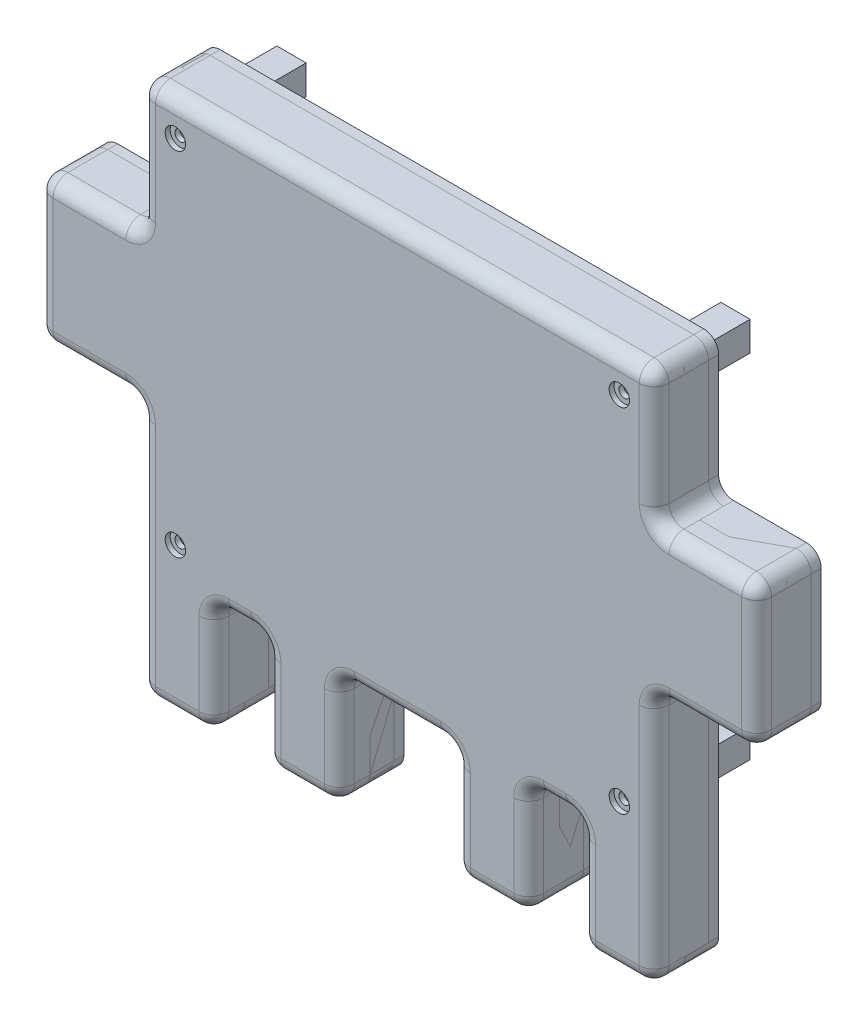
from build123d import *

# Parameters (mm, degrees)
PADTOP_W            = 77.3
PADTOP_H            = 39.1
PADTOP_W_2          = 20
PADTOP_H_2          = 20
PADTOP_W_3          = 20.655745754
PADTOP_H_3          = 29.195655742
PADTOP_R            = 3.75
PADTOP_W_4          = 11.1
PADTOP_H_4          = 11.1
PADTOP_W_5          = 14.76357624
PADTOP_H_5          = 22.646815711
EXTRUDE_1_DEPTH     = 7.8
EXTRUDE_START       = -2
PADTOP_8_W          = 77.3
PADTOP_8_H          = 39.1
PADTOP_8_W_2        = 20
PADTOP_8_H_2        = 20
PADTOP_8_W_3        = 20.655745754
PADTOP_8_H_3        = 29.195655742
PADTOP_8_R          = 3.75
PADTOP_8_W_4        = 14.76357624
PADTOP_8_H_4        = 22.646815711
PADTOP_8_W_5        = 14.1
PADTOP_8_H_5        = 14.1
EXTRUDE_4_DEPTH     = 2
EXTRUDE_6_DEPTH     = 11
FILLET_2_R          = 3
SHELL_1_T           = -2
FILLET_4_R          = 3
SKETCH_5_W          = 2
SKETCH_5_H          = 2
SKETCH_5_W_2        = 4
SKETCH_5_H_2        = 4
EXTRUDE_9_DEPTH     = 11.46
SKETCH_7_R          = 1.1
CUT_EXTRUDE_1_DEPTH = 2
SKETCH_7_4_R        = 2.05
SKETCH_7_4_R_2      = 1.1
CUT_EXTRUDE_2_DEPTH = 1
SKETCH_8_W          = 15.2
SKETCH_8_H          = 12.1
CUT_EXTRUDE_3_DEPTH = 7.4
SKETCH_5_4_W        = 5.9
SKETCH_5_4_H        = 5.9
SKETCH_5_4_W_2      = 1.9
SKETCH_5_4_H_2      = 1.9
EXTRUDE_11_DEPTH    = 10.4
PADTOP_9_W          = 20
PADTOP_9_H          = 20
PADTOP_9_W_2        = 11.1
PADTOP_9_H_2        = 11.1
CUT_EXTRUDE_4_DEPTH = 5
CHAMFER_1_SIZE      = 3


with BuildPart() as part:
    # padTop → 填料-伸長1 (new body)
    # profile 1 of 9: a face of its own
    with BuildSketch(Plane.XY):
        Polygon((124.130335016, 70.452577029), (20.692697881, 70.452577029), (20.692697881, 43.682608944), (20.692697881, 38.79106378), (24.836952127, 38.79106378), (24.836952127, 19.378498366), (20.692697881, 19.378498366), (20.692697881, 14.486953202), (20.692697881, -14.488569064), (35.456274121, -14.488569064), (45.956274121, -14.488569064), (60.719850361, -14.488569064), (84.103182536, -14.488569064), (98.866758776, -14.488569064), (109.366758776, -14.488569064), (124.130335016, -14.488569064), (124.130335016, 14.309507688), (124.130335016, 43.50516343), align=None)
        with Locations((72.411516449, 11.013549732)):
            Rectangle(PADTOP_W, PADTOP_H, mode=Mode.SUBTRACT)
        with Locations((42.913258478, 51.226372894)):
            Rectangle(PADTOP_W_2, PADTOP_H_2, mode=Mode.SUBTRACT)
        with Locations((102.073451812, 51.226372894)):
            Rectangle(PADTOP_W_2, PADTOP_H_2, mode=Mode.SUBTRACT)
    # profile 2 of 9: a face of its own
    with BuildSketch(Plane.XY):
        with Locations((134.458207893, 28.907335559)):
            Rectangle(PADTOP_W_3, PADTOP_H_3)
        with Locations((129.98608077, 29.084781073)):
            Circle(PADTOP_R, mode=Mode.SUBTRACT)
    # profile 3 of 9: a face of its own
    with BuildSketch(Plane.XY):
        Polygon((20.692697881, 38.79106378), (20.692697881, 43.682608944), (0.036952127, 43.682608944), (0.036952127, 14.486953202), (20.692697881, 14.486953202), (20.692697881, 19.378498366), (4.836952127, 19.378498366), (4.836952127, 38.79106378), align=None)
    # profile 4 of 9: a face of its own
    with BuildSketch(Plane.XY):
        with Locations((102.073451812, 51.226372894)):
            Rectangle(PADTOP_W_2, PADTOP_H_2)
        with Locations((102.073451812, 51.226372894)):
            Rectangle(PADTOP_W_4, PADTOP_H_4, mode=Mode.SUBTRACT)
    # profile 5 of 9: a face of its own
    with BuildSketch(Plane.XY):
        with Locations((42.913258478, 51.226372894)):
            Rectangle(PADTOP_W_2, PADTOP_H_2)
        with Locations((42.913258478, 51.226372894)):
            Rectangle(PADTOP_W_4, PADTOP_H_4, mode=Mode.SUBTRACT)
    # profile 6 of 9: a face of its own
    with BuildSketch(Plane.XY):
        with Locations((28.074486001, -25.81197692)):
            Rectangle(PADTOP_W_5, PADTOP_H_5)
    # profile 7 of 9: a face of its own
    with BuildSketch(Plane.XY):
        with Locations((53.338062241, -25.81197692)):
            Rectangle(PADTOP_W_5, PADTOP_H_5)
    # profile 8 of 9: a face of its own
    with BuildSketch(Plane.XY):
        with Locations((91.484970656, -25.81197692)):
            Rectangle(PADTOP_W_5, PADTOP_H_5)
    # profile 9 of 9: a face of its own
    with BuildSketch(Plane.XY):
        with Locations((116.748546896, -25.81197692)):
            Rectangle(PADTOP_W_5, PADTOP_H_5)
    extrude(amount=EXTRUDE_1_DEPTH)

    # padTop<8> → 填料-伸長4 (add)
    # profile 1 of 10: a face of its own
    with BuildSketch(Plane.XY.offset(EXTRUDE_START)):
        Polygon((124.130335016, 70.452577029), (20.692697881, 70.452577029), (20.692697881, 43.682608944), (20.692697881, 38.79106378), (24.836952127, 38.79106378), (24.836952127, 19.378498366), (20.692697881, 19.378498366), (20.692697881, 14.486953202), (20.692697881, -14.488569064), (35.456274121, -14.488569064), (45.956274121, -14.488569064), (60.719850361, -14.488569064), (84.103182536, -14.488569064), (98.866758776, -14.488569064), (109.366758776, -14.488569064), (124.130335016, -14.488569064), (124.130335016, 14.309507688), (124.130335016, 43.50516343), align=None)
        with Locations((72.411516449, 11.013549732)):
            Rectangle(PADTOP_8_W, PADTOP_8_H, mode=Mode.SUBTRACT)
        with Locations((42.913258478, 51.226372894)):
            Rectangle(PADTOP_8_W_2, PADTOP_8_H_2, mode=Mode.SUBTRACT)
        with Locations((102.073451812, 51.226372894)):
            Rectangle(PADTOP_8_W_2, PADTOP_8_H_2, mode=Mode.SUBTRACT)
    # profile 2 of 10: a face of its own
    with BuildSketch(Plane.XY.offset(EXTRUDE_START)):
        with Locations((134.458207893, 28.907335559)):
            Rectangle(PADTOP_8_W_3, PADTOP_8_H_3)
        with Locations((129.98608077, 29.084781073)):
            Circle(PADTOP_8_R, mode=Mode.SUBTRACT)
    # profile 3 of 10: a face of its own
    with BuildSketch(Plane.XY.offset(EXTRUDE_START)):
        Polygon((20.692697881, 38.79106378), (20.692697881, 43.682608944), (0.036952127, 43.682608944), (0.036952127, 14.486953202), (20.692697881, 14.486953202), (20.692697881, 19.378498366), (4.836952127, 19.378498366), (4.836952127, 38.79106378), align=None)
    # profile 4 of 10: a face of its own
    with BuildSketch(Plane.XY.offset(EXTRUDE_START)):
        with Locations((28.074486001, -25.81197692)):
            Rectangle(PADTOP_8_W_4, PADTOP_8_H_4)
    # profile 5 of 10: a face of its own
    with BuildSketch(Plane.XY.offset(EXTRUDE_START)):
        with Locations((53.338062241, -25.81197692)):
            Rectangle(PADTOP_8_W_4, PADTOP_8_H_4)
    # profile 6 of 10: a face of its own
    with BuildSketch(Plane.XY.offset(EXTRUDE_START)):
        with Locations((91.484970656, -25.81197692)):
            Rectangle(PADTOP_8_W_4, PADTOP_8_H_4)
    # profile 7 of 10: a face of its own
    with BuildSketch(Plane.XY.offset(EXTRUDE_START)):
        with Locations((116.748546896, -25.81197692)):
            Rectangle(PADTOP_8_W_4, PADTOP_8_H_4)
    # profile 8 of 10: a face of its own
    with BuildSketch(Plane.XY.offset(EXTRUDE_START)):
        with Locations((72.411516449, 11.013549732)):
            Rectangle(PADTOP_8_W, PADTOP_8_H)
        with Locations((43.761516449, 20.563549732)):
            Rectangle(PADTOP_8_W_5, PADTOP_8_H_5, mode=Mode.SUBTRACT)
        with Locations((43.761516449, 1.463549732)):
            Rectangle(PADTOP_8_W_5, PADTOP_8_H_5, mode=Mode.SUBTRACT)
        with Locations((101.061516449, 20.563549732)):
            Rectangle(PADTOP_8_W_5, PADTOP_8_H_5, mode=Mode.SUBTRACT)
        with Locations((101.061516449, 1.463549732)):
            Rectangle(PADTOP_8_W_5, PADTOP_8_H_5, mode=Mode.SUBTRACT)
        with Locations((62.861516449, 20.563549732)):
            Rectangle(PADTOP_8_W_5, PADTOP_8_H_5, mode=Mode.SUBTRACT)
        with Locations((62.861516449, 1.463549732)):
            Rectangle(PADTOP_8_W_5, PADTOP_8_H_5, mode=Mode.SUBTRACT)
        with Locations((81.961516449, 20.563549732)):
            Rectangle(PADTOP_8_W_5, PADTOP_8_H_5, mode=Mode.SUBTRACT)
        with Locations((81.961516449, 1.463549732)):
            Rectangle(PADTOP_8_W_5, PADTOP_8_H_5, mode=Mode.SUBTRACT)
    # profile 9 of 10: a face of its own
    with BuildSketch(Plane.XY.offset(EXTRUDE_START)):
        Polygon((20.692697881, 36.134781073), (20.692697881, 38.79106378), (4.836952127, 38.79106378), (4.836952127, 19.378498366), (20.692697881, 19.378498366), (20.692697881, 22.034781073), (7.786952127, 22.034781073), (7.786952127, 36.134781073), align=None)
    # profile 10 of 10: a face of its own
    with BuildSketch(Plane.XY.offset(EXTRUDE_START)):
        Polygon((24.836952127, 38.79106378), (20.692697881, 38.79106378), (20.692697881, 36.134781073), (21.886952127, 36.134781073), (21.886952127, 22.034781073), (20.692697881, 22.034781073), (20.692697881, 19.378498366), (24.836952127, 19.378498366), align=None)
    extrude(amount=EXTRUDE_4_DEPTH)

    # 圓角4
    fillet_4_edges = [part.edges().sort_by_distance(p)[0] for p in [
        (10.364825004, 14.486953202, 7.8),
        (35.456274121, -37.135384775, 2.9),
        (20.692697881, -37.135384775, 2.9),
        (35.456274121, -25.811976919, 7.8),
        (28.074486001, -37.135384775, 7.8),
        (60.719850361, -37.135384775, 2.9),
        (45.956274121, -37.135384775, 2.9),
        (45.956274121, -25.811976919, 7.8),
        (60.719850361, -25.811976919, 7.8),
        (53.338062241, -37.135384775, 7.8),
        (98.866758776, -37.135384775, 2.9),
        (84.103182536, -37.135384775, 2.9),
        (84.103182536, -25.811976919, 7.8),
        (98.866758776, -25.811976919, 7.8),
        (91.484970656, -37.135384775, 7.8),
        (124.130335016, -37.135384775, 2.9),
        (109.366758776, -37.135384775, 2.9),
        (109.366758776, -25.811976919, 7.8),
        (116.748546896, -37.135384775, 7.8),
        (20.692697881, -11.324215786, 7.8),
        (124.130335016, -11.412938543, 7.8),
        (134.458207893, 14.309507688, 7.8),
        (144.78608077, 28.907335559, 7.8),
        (134.458207893, 43.50516343, 7.8),
        (124.130335016, 56.97887023, 7.8),
        (72.411516449, 70.452577029, 7.8),
        (0.036952127, 14.486953202, 2.9),
        (0.036952127, 43.682608944, 2.9),
        (20.692697881, 43.682608944, 2.9),
        (20.692697881, 70.452577029, 2.9),
        (124.130335016, 70.452577029, 2.9),
        (124.130335016, 43.50516343, 2.9),
        (144.78608077, 43.50516343, 2.9),
        (144.78608077, 14.309507688, 2.9),
        (124.130335016, 14.309507688, 2.9),
        (20.692697881, 57.067592987, 7.8),
        (20.692697881, 14.486953202, 2.9),
        (10.364825004, 43.682608944, 7.8),
        (0.036952127, 29.084781073, 7.8),
        (40.706274121, -14.488569064, 7.8),
        (72.411516449, -14.488569064, 7.8),
        (104.116758776, -14.488569064, 7.8),
        (109.366758776, -14.488569064, 2.9),
        (98.866758776, -14.488569064, 2.9),
        (84.103182536, -14.488569064, 2.9),
        (60.719850361, -14.488569064, 2.9),
        (45.956274121, -14.488569064, 2.9),
        (35.456274121, -14.488569064, 2.9),
    ]]
    fillet(fillet_4_edges, radius=FILLET_4_R)

    # 草圖5 → 填料-伸長9 (add)
    with BuildSketch(Plane.XY.offset(-2)):
        with Locations((91.511516449, 11.013549732)):
            Rectangle(SKETCH_5_W, SKETCH_5_H)
        with Locations((88.511516449, 11.013549732)):
            Rectangle(SKETCH_5_W_2, SKETCH_5_H)
        with Locations((91.511516449, 14.013549732)):
            Rectangle(SKETCH_5_W, SKETCH_5_H_2)
        with Locations((91.511516449, 8.013549732)):
            Rectangle(SKETCH_5_W, SKETCH_5_H_2)
        with Locations((94.511516449, 11.013549732)):
            Rectangle(SKETCH_5_W_2, SKETCH_5_H)
        with Locations((53.311516449, 11.013549732)):
            Rectangle(SKETCH_5_W, SKETCH_5_H)
        with Locations((50.311516449, 11.013549732)):
            Rectangle(SKETCH_5_W_2, SKETCH_5_H)
        with Locations((53.311516449, 14.013549732)):
            Rectangle(SKETCH_5_W, SKETCH_5_H_2)
        with Locations((56.311516449, 11.013549732)):
            Rectangle(SKETCH_5_W_2, SKETCH_5_H)
        with Locations((53.311516449, 8.013549732)):
            Rectangle(SKETCH_5_W, SKETCH_5_H_2)
    extrude(amount=-EXTRUDE_9_DEPTH)

    # 草圖8 → 除料-伸長3 (cut)
    with BuildSketch(Plane(origin=(0, 0, -2), x_dir=(-1, 0, 0), z_dir=(0, 0, -1))):
        with Locations((-129.98608077, 29.084781073)):
            Rectangle(SKETCH_8_W, SKETCH_8_H)
    extrude(amount=-CUT_EXTRUDE_3_DEPTH, mode=Mode.SUBTRACT)

    # 草圖5<4> → 填料-伸長11 (add)
    # profile 1 of 4: a face of its own
    with BuildSketch(Plane.XY.offset(-2)):
        with Locations((117.130335016, 63.452577029)):
            Rectangle(SKETCH_5_4_W, SKETCH_5_4_H)
        with Locations((117.130335016, 63.452577029)):
            Rectangle(SKETCH_5_4_W_2, SKETCH_5_4_H_2, mode=Mode.SUBTRACT)
    # profile 2 of 4: a face of its own
    with BuildSketch(Plane.XY.offset(-2)):
        with Locations((117.130335016, -7.488569064)):
            Rectangle(SKETCH_5_4_W, SKETCH_5_4_H)
        with Locations((117.130335016, -7.488569064)):
            Rectangle(SKETCH_5_4_W_2, SKETCH_5_4_H_2, mode=Mode.SUBTRACT)
    # profile 3 of 4: a face of its own
    with BuildSketch(Plane.XY.offset(-2)):
        with Locations((27.692697881, -7.488569064)):
            Rectangle(SKETCH_5_4_W, SKETCH_5_4_H)
        with Locations((27.692697881, -7.488569064)):
            Rectangle(SKETCH_5_4_W_2, SKETCH_5_4_H_2, mode=Mode.SUBTRACT)
    # profile 4 of 4: a face of its own
    with BuildSketch(Plane.XY.offset(-2)):
        with Locations((27.692697881, 63.452577029)):
            Rectangle(SKETCH_5_4_W, SKETCH_5_4_H)
        with Locations((27.692697881, 63.452577029)):
            Rectangle(SKETCH_5_4_W_2, SKETCH_5_4_H_2, mode=Mode.SUBTRACT)
    extrude(amount=-EXTRUDE_11_DEPTH)

    # padTop<9> → 除料-伸長4 (cut)
    # profile 1 of 2: a face of its own
    with BuildSketch(Plane.XY):
        with Locations((102.073451812, 51.226372894)):
            Rectangle(PADTOP_9_W, PADTOP_9_H)
        with Locations((102.073451812, 51.226372894)):
            Rectangle(PADTOP_9_W_2, PADTOP_9_H_2, mode=Mode.SUBTRACT)
    # profile 2 of 2: a face of its own
    with BuildSketch(Plane.XY):
        with Locations((42.913258478, 51.226372894)):
            Rectangle(PADTOP_9_W, PADTOP_9_H)
        with Locations((42.913258478, 51.226372894)):
            Rectangle(PADTOP_9_W_2, PADTOP_9_H_2, mode=Mode.SUBTRACT)
    extrude(amount=CUT_EXTRUDE_4_DEPTH, mode=Mode.SUBTRACT)

    # 導角1
    # the kernel refuses this chamfer: 3 mm, written as the material it adds along each edge
    with BuildSketch(Plane(origin=(114.180335016, 60.502577029, -2), x_dir=(-1, 0, 0), z_dir=(0, 1, 0))) as chamfer_1_piece_1_section:
        Polygon((CHAMFER_1_SIZE, 0), (0, -CHAMFER_1_SIZE), (0, 0), align=None)
    chamfer_1_piece_1 = extrude(amount=5.9, mode=Mode.PRIVATE)
    chamfer_1_piece_1 = split(chamfer_1_piece_1, bisect_by=Plane(origin=(112.073451812, 60.502577029, -2), z_dir=(1, 0, 0)), keep=Keep.TOP, mode=Mode.PRIVATE)
    add(chamfer_1_piece_1)
    with BuildSketch(Plane(origin=(114.180335016, 52.787528065, -2), x_dir=(-1, 0, 0), z_dir=(0, 1, 0))) as chamfer_1_piece_2_section:
        Polygon((CHAMFER_1_SIZE, 0), (0, -CHAMFER_1_SIZE), (0, 0), align=None)
    chamfer_1_piece_2 = extrude(amount=13.615048964, mode=Mode.PRIVATE)
    chamfer_1_piece_2 = split(chamfer_1_piece_2, bisect_by=Plane(origin=(114.180335016, 61.226372894, -2), z_dir=(0, 1, 0)), keep=Keep.TOP, mode=Mode.PRIVATE)
    add(chamfer_1_piece_2)
    with BuildSketch(Plane(origin=(120.080335016, 60.502577029, -2), x_dir=(0, -1, 0), z_dir=(-1, 0, 0)), Plane(origin=(114.180335016, -4.538569064, -2), x_dir=(0, 1, 0), z_dir=(1, 0, 0)), Plane(origin=(120.080335016, -10.438569064, -2), x_dir=(0, -1, 0), z_dir=(-1, 0, 0)), Plane(origin=(24.742697881, -4.538569064, -2), x_dir=(0, 1, 0), z_dir=(1, 0, 0)), Plane(origin=(30.642697881, -10.438569064, -2), x_dir=(0, -1, 0), z_dir=(-1, 0, 0)), Plane(origin=(30.642697881, 60.502577029, -2), x_dir=(0, -1, 0), z_dir=(-1, 0, 0))) as chamfer_1_piece_3:
        Polygon((CHAMFER_1_SIZE, 0), (0, -CHAMFER_1_SIZE), (0, 0), align=None)
    extrude(amount=5.9)
    with BuildSketch(Plane(origin=(30.642697881, 66.402577029, -2), x_dir=(1, 0, 0), z_dir=(0, -1, 0))) as chamfer_1_piece_4_section:
        Polygon((CHAMFER_1_SIZE, 0), (0, -CHAMFER_1_SIZE), (0, 0), align=None)
    chamfer_1_piece_4 = extrude(amount=13.615048964, mode=Mode.PRIVATE)
    chamfer_1_piece_4 = split(chamfer_1_piece_4, bisect_by=Plane(origin=(30.642697881, 61.226372894, -2), z_dir=(0, 1, 0)), keep=Keep.TOP, mode=Mode.PRIVATE)
    add(chamfer_1_piece_4)
    with BuildSketch(Plane(origin=(30.642697881, 66.402577029, -2), x_dir=(1, 0, 0), z_dir=(0, -1, 0))) as chamfer_1_piece_5_section:
        Polygon((CHAMFER_1_SIZE, 0), (0, -CHAMFER_1_SIZE), (0, 0), align=None)
    chamfer_1_piece_5 = extrude(amount=5.9, mode=Mode.PRIVATE)
    chamfer_1_piece_5 = split(chamfer_1_piece_5, bisect_by=Plane(origin=(32.913258478, 66.402577029, -2), z_dir=(-1, 0, 0)), keep=Keep.TOP, mode=Mode.PRIVATE)
    add(chamfer_1_piece_5)
    with BuildSketch(Plane(origin=(114.180335016, 52.787528065, -2), x_dir=(-1, 0, 0), z_dir=(0, 1, 0))) as chamfer_1_piece_6a_section:
        Polygon((CHAMFER_1_SIZE, 0), (0, -CHAMFER_1_SIZE), (0, 0), align=None)
    chamfer_1_piece_6a = extrude(amount=13.615048964, mode=Mode.PRIVATE)
    chamfer_1_piece_6a = split(chamfer_1_piece_6a, bisect_by=Plane(origin=(112.073451812, 52.787528065, -2), z_dir=(1, 0, 0)), keep=Keep.TOP, mode=Mode.PRIVATE)
    chamfer_1_piece_6a = split(chamfer_1_piece_6a, bisect_by=Plane(origin=(114.180335016, 60.502577029, -2), z_dir=(0, -1, 0)), keep=Keep.TOP, mode=Mode.PRIVATE)
    with BuildSketch(Plane(origin=(120.080335016, 60.502577029, -2), x_dir=(0, -1, 0), z_dir=(-1, 0, 0))) as chamfer_1_piece_6b_section:
        Polygon((CHAMFER_1_SIZE, 0), (0, -CHAMFER_1_SIZE), (0, 0), align=None)
    chamfer_1_piece_6b = extrude(amount=13.615048964, mode=Mode.PRIVATE)
    chamfer_1_piece_6b = split(chamfer_1_piece_6b, bisect_by=Plane(origin=(112.073451812, 60.502577029, -2), z_dir=(1, 0, 0)), keep=Keep.TOP, mode=Mode.PRIVATE)
    chamfer_1_piece_6b = split(chamfer_1_piece_6b, bisect_by=Plane(origin=(114.180335016, 60.502577029, -2), z_dir=(-1, 0, 0)), keep=Keep.TOP, mode=Mode.PRIVATE)
    chamfer_1_piece_6 = chamfer_1_piece_6a & chamfer_1_piece_6b
    add(chamfer_1_piece_6)
    with BuildSketch(Plane(origin=(38.357746845, 60.502577029, -2), x_dir=(0, -1, 0), z_dir=(-1, 0, 0))) as chamfer_1_piece_7a_section:
        Polygon((CHAMFER_1_SIZE, 0), (0, -CHAMFER_1_SIZE), (0, 0), align=None)
    chamfer_1_piece_7a = extrude(amount=13.615048964, mode=Mode.PRIVATE)
    chamfer_1_piece_7a = split(chamfer_1_piece_7a, bisect_by=Plane(origin=(32.913258478, 60.502577029, -2), z_dir=(-1, 0, 0)), keep=Keep.TOP, mode=Mode.PRIVATE)
    chamfer_1_piece_7a = split(chamfer_1_piece_7a, bisect_by=Plane(origin=(30.642697881, 60.502577029, -2), z_dir=(1, 0, 0)), keep=Keep.TOP, mode=Mode.PRIVATE)
    with BuildSketch(Plane(origin=(30.642697881, 66.402577029, -2), x_dir=(1, 0, 0), z_dir=(0, -1, 0))) as chamfer_1_piece_7b_section:
        Polygon((CHAMFER_1_SIZE, 0), (0, -CHAMFER_1_SIZE), (0, 0), align=None)
    chamfer_1_piece_7b = extrude(amount=13.615048964, mode=Mode.PRIVATE)
    chamfer_1_piece_7b = split(chamfer_1_piece_7b, bisect_by=Plane(origin=(32.913258478, 66.402577029, -2), z_dir=(-1, 0, 0)), keep=Keep.TOP, mode=Mode.PRIVATE)
    chamfer_1_piece_7b = split(chamfer_1_piece_7b, bisect_by=Plane(origin=(30.642697881, 60.502577029, -2), z_dir=(0, -1, 0)), keep=Keep.TOP, mode=Mode.PRIVATE)
    chamfer_1_piece_7 = chamfer_1_piece_7a & chamfer_1_piece_7b
    add(chamfer_1_piece_7)


with BuildPart() as body_2:
    # 草圖2 → 填料-伸長6 (new body)
    with BuildSketch(Plane.XY):
        Polygon((20.692697881, 43.682608944), (0.036952127, 43.682608944), (0.036952127, 14.486953202), (20.692697881, 14.486953202), (20.692697881, -37.135384775), (35.456274121, -37.135384775), (35.456274121, -14.488569064), (45.956274121, -14.488569064), (45.956274121, -37.135384775), (60.719850361, -37.135384775), (60.719850361, -14.488569064), (84.103182536, -14.488569064), (84.103182536, -37.135384775), (98.866758776, -37.135384775), (98.866758776, -14.488569064), (109.366758776, -14.488569064), (109.366758776, -37.135384775), (124.130335016, -37.135384775), (124.130335016, 14.309507688), (144.78608077, 14.309507688), (144.78608077, 43.50516343), (124.130335016, 43.50516343), (124.130335016, 70.452577029), (20.692697881, 70.452577029), align=None)
    extrude(amount=EXTRUDE_6_DEPTH)

    # 圓角2
    fillet_2_edges = [body_2.edges().sort_by_distance(p)[0] for p in [
        (0.036952127, 29.084781073, 11),
        (10.364825004, 14.486953202, 11),
        (20.692697881, -11.324215786, 11),
        (28.074486001, -37.135384775, 11),
        (35.456274121, -25.811976919, 11),
        (40.706274121, -14.488569064, 11),
        (45.956274121, -25.811976919, 11),
        (20.692697881, 70.452577029, 5.5),
        (124.130335016, 70.452577029, 5.5),
        (124.130335016, 43.50516343, 5.5),
        (144.78608077, 43.50516343, 5.5),
        (144.78608077, 14.309507688, 5.5),
        (124.130335016, 14.309507688, 5.5),
        (124.130335016, -37.135384775, 5.5),
        (109.366758776, -37.135384775, 5.5),
        (109.366758776, -14.488569064, 5.5),
        (98.866758776, -14.488569064, 5.5),
        (98.866758776, -37.135384775, 5.5),
        (53.338062241, -37.135384775, 11),
        (84.103182536, -37.135384775, 5.5),
        (84.103182536, -14.488569064, 5.5),
        (60.719850361, -14.488569064, 5.5),
        (60.719850361, -37.135384775, 5.5),
        (45.956274121, -37.135384775, 5.5),
        (45.956274121, -14.488569064, 5.5),
        (35.456274121, -14.488569064, 5.5),
        (35.456274121, -37.135384775, 5.5),
        (20.692697881, -37.135384775, 5.5),
        (20.692697881, 14.486953202, 5.5),
        (0.036952127, 14.486953202, 5.5),
        (0.036952127, 43.682608944, 5.5),
        (20.692697881, 43.682608944, 5.5),
        (60.719850361, -25.811976919, 11),
        (72.411516449, -14.488569064, 11),
        (20.692697881, 57.067592987, 11),
        (84.103182536, -25.811976919, 11),
        (91.484970656, -37.135384775, 11),
        (98.866758776, -25.811976919, 11),
        (104.116758776, -14.488569064, 11),
        (109.366758776, -25.811976919, 11),
        (116.748546896, -37.135384775, 11),
        (124.130335016, -11.412938543, 11),
        (134.458207893, 14.309507688, 11),
        (144.78608077, 28.907335559, 11),
        (134.458207893, 43.50516343, 11),
        (10.364825004, 43.682608944, 11),
        (124.130335016, 56.97887023, 11),
        (72.411516449, 70.452577029, 11),
    ]]
    fillet(fillet_2_edges, radius=FILLET_2_R)

    # 薄殼1
    shell_1_openings = [body_2.faces().sort_by_distance(p)[0] for p in [
        (72.411516449, 21.765183813, 0),
    ]]
    offset(amount=SHELL_1_T, openings=shell_1_openings, kind=Kind.INTERSECTION)

    # 草圖7 → 除料-伸長1 (cut)
    with BuildSketch(Plane.XY.offset(11)):
        with Locations((27.692697881, 63.452577029)):
            Circle(SKETCH_7_R)
        with Locations((117.130335016, 63.452577029)):
            Circle(SKETCH_7_R)
        with Locations((117.130335016, -7.488569064)):
            Circle(SKETCH_7_R)
        with Locations((27.692697881, -7.488569064)):
            Circle(SKETCH_7_R)
    extrude(amount=-CUT_EXTRUDE_1_DEPTH, mode=Mode.SUBTRACT)

    # 草圖7<4> → 除料-伸長2 (cut)
    # profile 1 of 4: a face of its own
    with BuildSketch(Plane.XY.offset(11)):
        with Locations((27.692697881, 63.452577029)):
            Circle(SKETCH_7_4_R)
        with Locations((27.692697881, 63.452577029)):
            Circle(SKETCH_7_4_R_2, mode=Mode.SUBTRACT)
    # profile 2 of 4: a face of its own
    with BuildSketch(Plane.XY.offset(11)):
        with Locations((117.130335016, 63.452577029)):
            Circle(SKETCH_7_4_R)
        with Locations((117.130335016, 63.452577029)):
            Circle(SKETCH_7_4_R_2, mode=Mode.SUBTRACT)
    # profile 3 of 4: a face of its own
    with BuildSketch(Plane.XY.offset(11)):
        with Locations((117.130335016, -7.488569064)):
            Circle(SKETCH_7_4_R)
        with Locations((117.130335016, -7.488569064)):
            Circle(SKETCH_7_4_R_2, mode=Mode.SUBTRACT)
    # profile 4 of 4: a face of its own
    with BuildSketch(Plane.XY.offset(11)):
        with Locations((27.692697881, -7.488569064)):
            Circle(SKETCH_7_4_R)
        with Locations((27.692697881, -7.488569064)):
            Circle(SKETCH_7_4_R_2, mode=Mode.SUBTRACT)
    extrude(amount=-CUT_EXTRUDE_2_DEPTH, mode=Mode.SUBTRACT)


solid = Compound([part.part, body_2.part])
